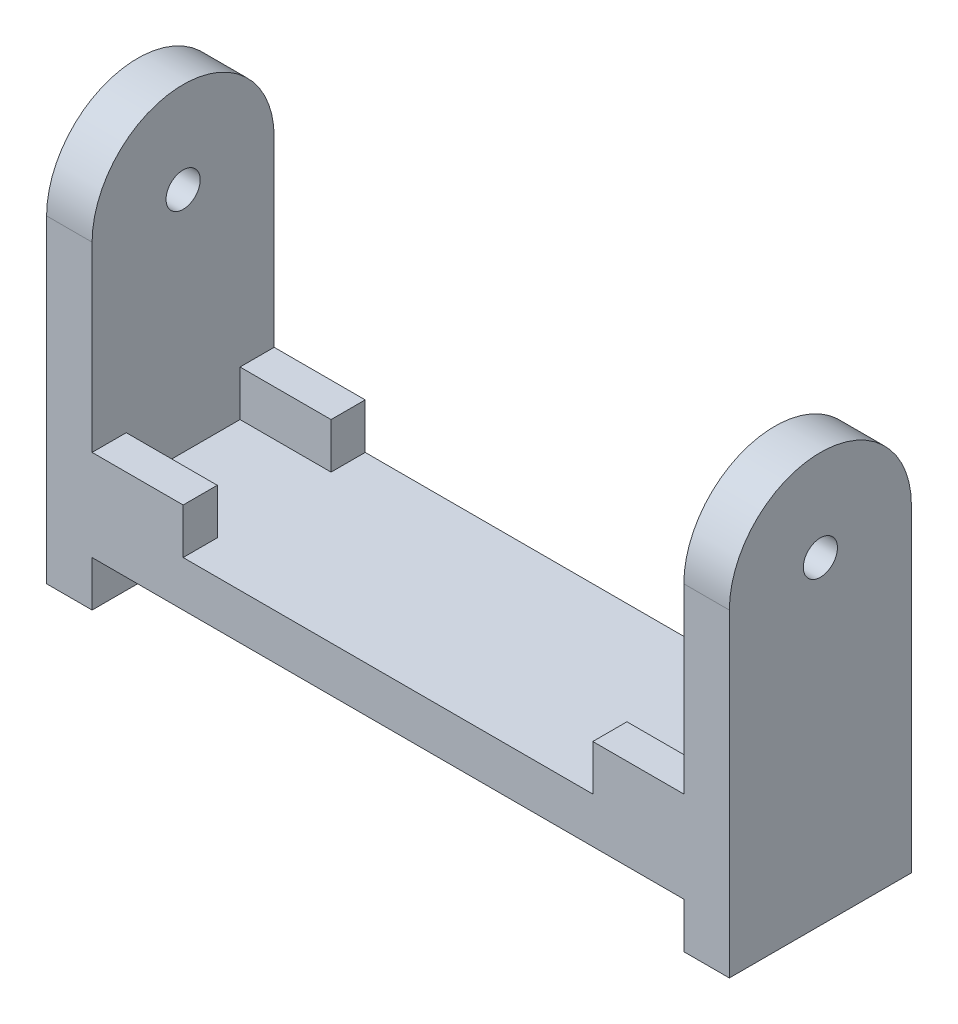
from build123d import *

# Parameters (mm, degrees)
SKETCH_2_R             = 7.5
EXTRUDE_1_DEPTH        = 300
SKETCH_3_W             = 260
SKETCH_3_H             = 140
CUT_EXTRUDE_1_DEPTH    = 333.866339542
SKETCH_4_W             = 20
SKETCH_4_H             = 80
EXTRUDE_2_DEPTH        = 20
SKETCH_5_R             = 5
CUT_EXTRUDE_1283_DEPTH = 20
SKETCH_7_W             = 40
SKETCH_7_H             = 15
EXTRUDE_1635_DEPTH     = 20


with BuildPart() as part:
    # 草圖2 → 填料-伸長1 (new body)
    with BuildSketch(Plane(origin=(0, 0, 0), x_dir=(0, 0, -1), z_dir=(1, 0, 0))):
        with BuildLine():
            Line((-40, 0), (-40, -120))
            Line((-40, -120), (40, -120))
            Line((40, -120), (40, 0))
            ThreePointArc((40, 0), (0, 40), (-40, 0))
        make_face()
        Circle(SKETCH_2_R, mode=Mode.SUBTRACT)
    extrude(amount=EXTRUDE_1_DEPTH)

    # 草圖3 → 除料-伸長1 (cut, through all)
    with BuildSketch(Plane(origin=(0, 0, -40), x_dir=(-1, 0, 0), z_dir=(0, 0, -1))):
        with Locations((-150, -30)):
            Rectangle(SKETCH_3_W, SKETCH_3_H)
    extrude(amount=-CUT_EXTRUDE_1_DEPTH, mode=Mode.SUBTRACT)

    # 草圖4 → 填料-伸長2 (add)
    with BuildSketch(Plane.XZ.offset(120)):
        with Locations((10, 0)):
            Rectangle(SKETCH_4_W, SKETCH_4_H)
        with Locations((290, 0)):
            Rectangle(SKETCH_4_W, SKETCH_4_H)
    extrude(amount=EXTRUDE_2_DEPTH)

    # 草圖5 → Cut-Extrude 1283 (cut)
    with BuildSketch(Plane.XZ.offset(140)):
        with Locations((10, 0)):
            Circle(SKETCH_5_R)
        with Locations((290, 0)):
            Circle(SKETCH_5_R)
    extrude(amount=-CUT_EXTRUDE_1283_DEPTH, mode=Mode.SUBTRACT)

    # 草圖7 → Extrude 1635 (add)
    with BuildSketch(Plane(origin=(0, -100, 0), x_dir=(1, 0, 0), z_dir=(0, 1, 0))):
        with Locations((40, 32.5)):
            Rectangle(SKETCH_7_W, SKETCH_7_H)
        with Locations((40, -32.5)):
            Rectangle(SKETCH_7_W, SKETCH_7_H)
        with Locations((260, -32.5)):
            Rectangle(SKETCH_7_W, SKETCH_7_H)
        with Locations((260, 32.5)):
            Rectangle(SKETCH_7_W, SKETCH_7_H)
    extrude(amount=EXTRUDE_1635_DEPTH)


solid = part.part
